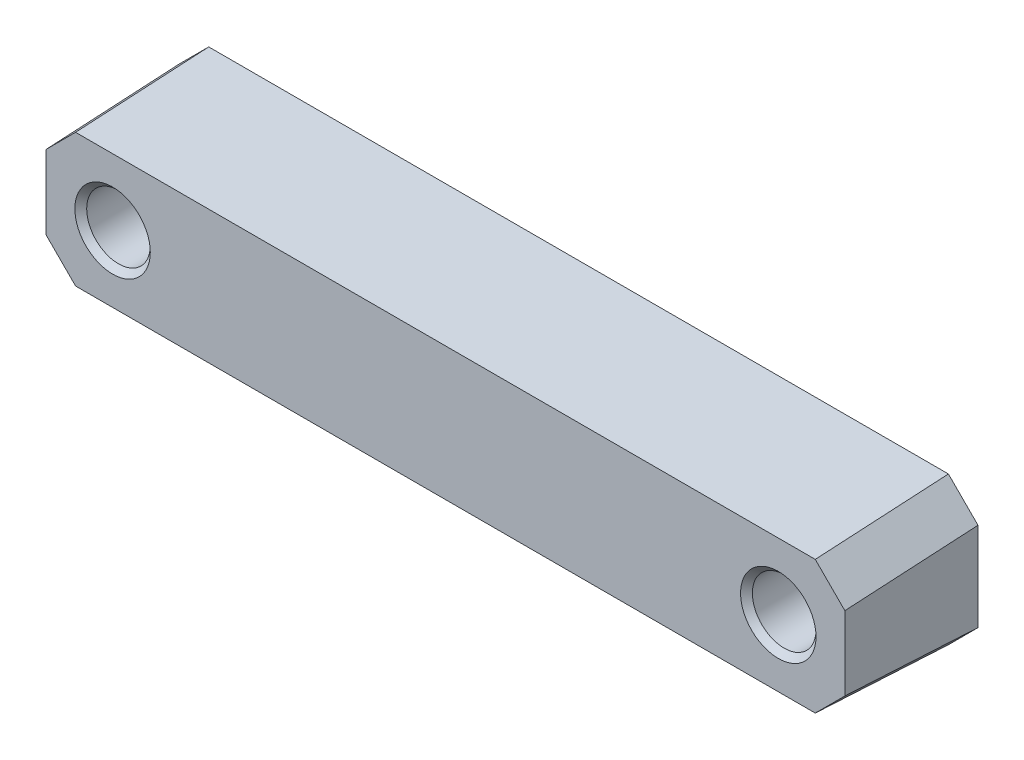
from build123d import *

# Parameters (mm, degrees)
SKETCH3_R          = 2.15
CUT_EXTRUDE1_DEPTH = 10
CHAMFER1_SIZE      = 0.4
CHAMFER2_SIZE      = 2
CHAMFER3_SIZE      = 2


with BuildPart() as part:
    # Sketch1 → Loft1 section 0
    with BuildSketch(Plane.XY):
        with BuildLine():
            Line((0, 0), (54, 0))
            Line((54, 0), (54, 10))
            Line((54, 10), (0, 10))
            Line((0, 10), (0, 0))
        make_face()
    # Sketch2 → Loft1 section 1
    with BuildSketch(Plane.XY.offset(9)):
        with BuildLine():
            Line((0, 9.5), (54, 9.5))
            Line((54, 9.5), (54, 0.5))
            Line((54, 0.5), (0, 0.5))
            Line((0, 0.5), (0, 9.5))
        make_face()
    loft()

    # Sketch3 → Cut-Extrude1 (cut)
    with BuildSketch(Plane(origin=(0, 0, 0), x_dir=(-1, 0, 0), z_dir=(0, 0, -1))):
        with Locations((-49.5, 5)):
            Circle(SKETCH3_R)
        with Locations((-4.5, 5)):
            Circle(SKETCH3_R)
    extrude(amount=-CUT_EXTRUDE1_DEPTH, mode=Mode.SUBTRACT)

    # Chamfer1
    chamfer1_edges = [part.edges().sort_by_distance(p)[0] for p in [
        (6.65, 5, 0),
        (6.65, 5, 9),
        (51.65, 5, 0),
        (51.65, 5, 9),
    ]]
    chamfer(chamfer1_edges, length=CHAMFER1_SIZE)

    # Chamfer2
    chamfer2_edges = [part.edges().sort_by_distance(p)[0] for p in [
        (0, 9.75, 4.5),
        (54, 9.75, 4.5),
    ]]
    chamfer(chamfer2_edges, length=CHAMFER2_SIZE)

    # Chamfer3
    chamfer3_edges = [part.edges().sort_by_distance(p)[0] for p in [
        (54, 0.25, 4.5),
        (0, 0.25, 4.5),
    ]]
    chamfer(chamfer3_edges, length=CHAMFER3_SIZE)


solid = part.part
